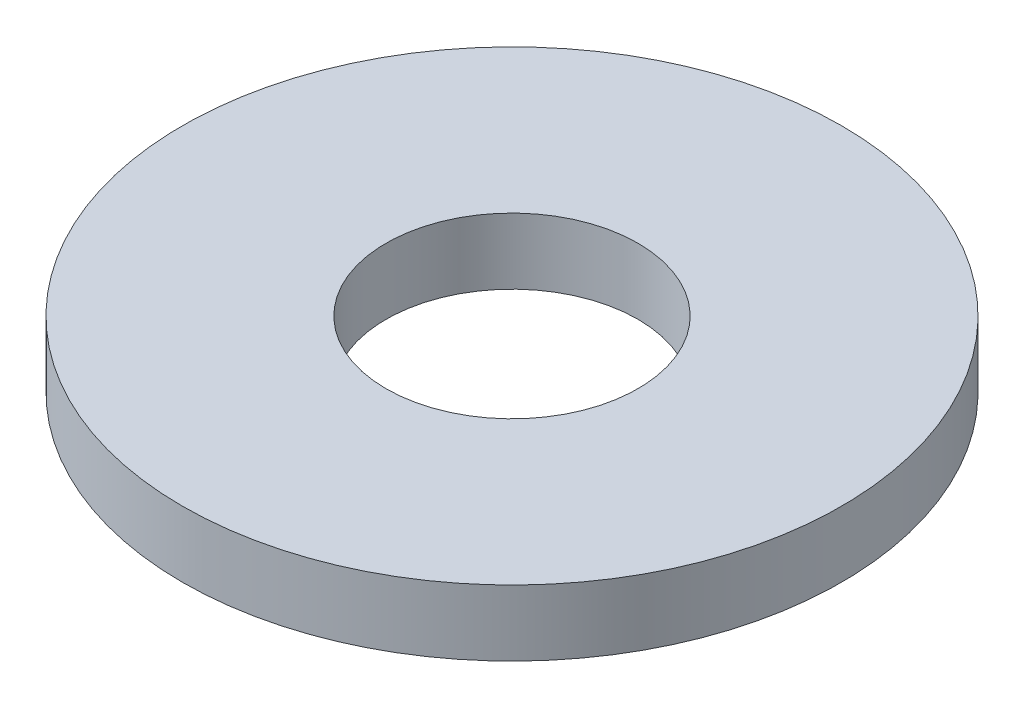
from build123d import *

# Parameters (mm, degrees)
SKETCH1_R           = 85
BOSS_EXTRUDE1_DEPTH = 17
SKETCH2_R           = 32.5
CUT_EXTRUDE1_DEPTH  = 122.404283285


with BuildPart() as part:
    # Sketch1 → Boss-Extrude1 (new body)
    with BuildSketch(Plane(origin=(0, 0, 0), x_dir=(1, 0, 0), z_dir=(0, 1, 0))):
        Circle(SKETCH1_R)
    extrude(amount=BOSS_EXTRUDE1_DEPTH)

    # Sketch2 → Cut-Extrude1 (cut, through all)
    with BuildSketch(Plane(origin=(0, 0, 0), x_dir=(1, 0, 0), z_dir=(0, 1, 0))):
        Circle(SKETCH2_R)
    extrude(amount=CUT_EXTRUDE1_DEPTH, mode=Mode.SUBTRACT)


solid = part.part
